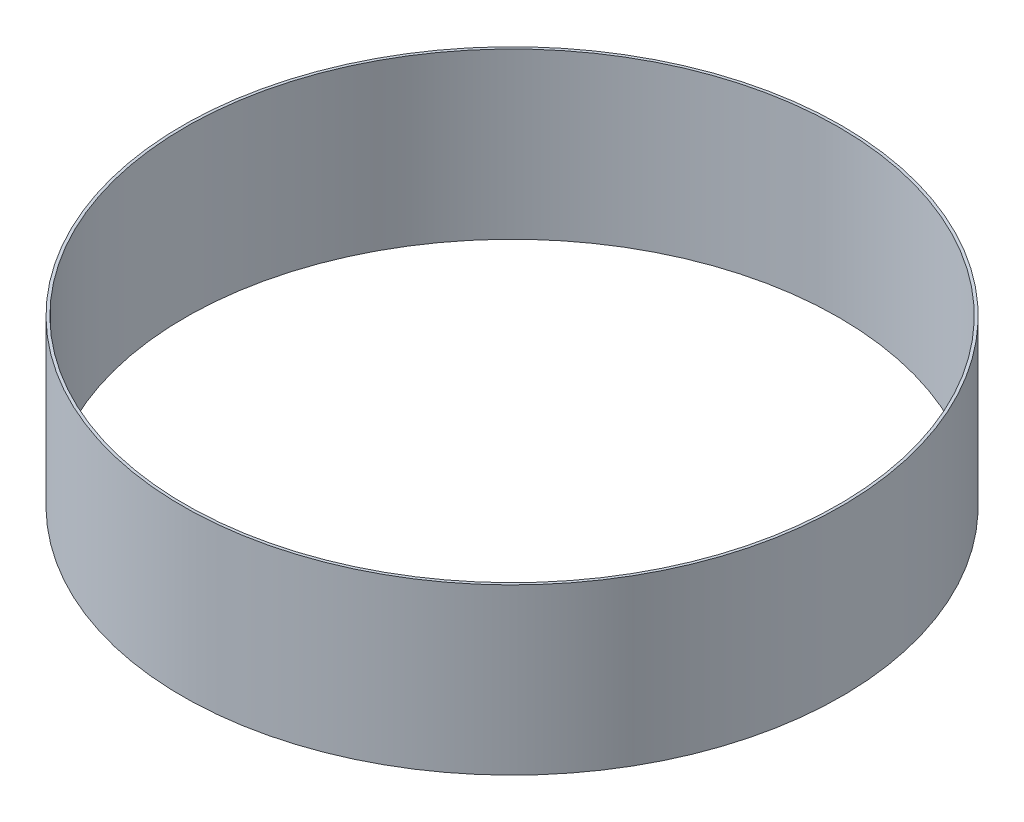
from build123d import *

# Parameters (mm, degrees)
SKETCH2_R           = 152.4
SKETCH2_R_2         = 151.13
BOSS_EXTRUDE1_DEPTH = 76.2


with BuildPart() as part:
    # Sketch2 → Boss-Extrude1 (new body)
    with BuildSketch(Plane(origin=(0, 0, 0), x_dir=(1, 0, 0), z_dir=(0, 1, 0))):
        Circle(SKETCH2_R)
        Circle(SKETCH2_R_2, mode=Mode.SUBTRACT)
    extrude(amount=BOSS_EXTRUDE1_DEPTH)


solid = part.part
